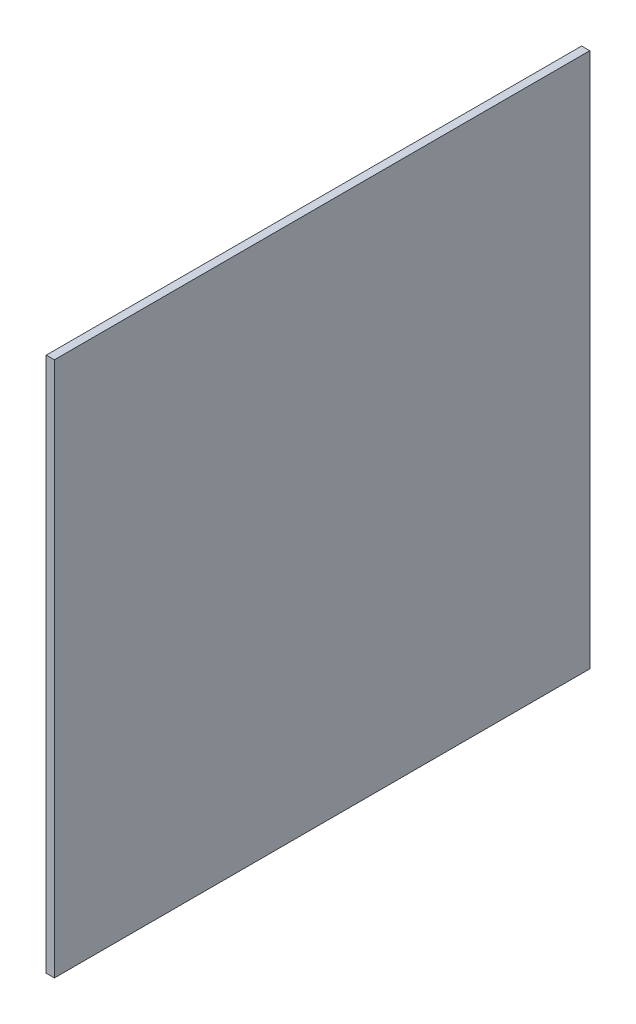
from build123d import *

# Parameters (mm, degrees)
SKETCH1_W          = 50
SKETCH1_H          = 50
BASE_FLANGE1_DEPTH = 0.76


# Sheet-metal steps are written as plain solids
with BuildPart() as part:
    # Sketch1 → Base-Flange1 (new body)
    with BuildSketch(Plane(origin=(0, 0, 0), x_dir=(0, 0, -1), z_dir=(1, 0, 0))):
        with Locations((25, 25)):
            Rectangle(SKETCH1_W, SKETCH1_H)
    extrude(amount=-BASE_FLANGE1_DEPTH)


solid = part.part
